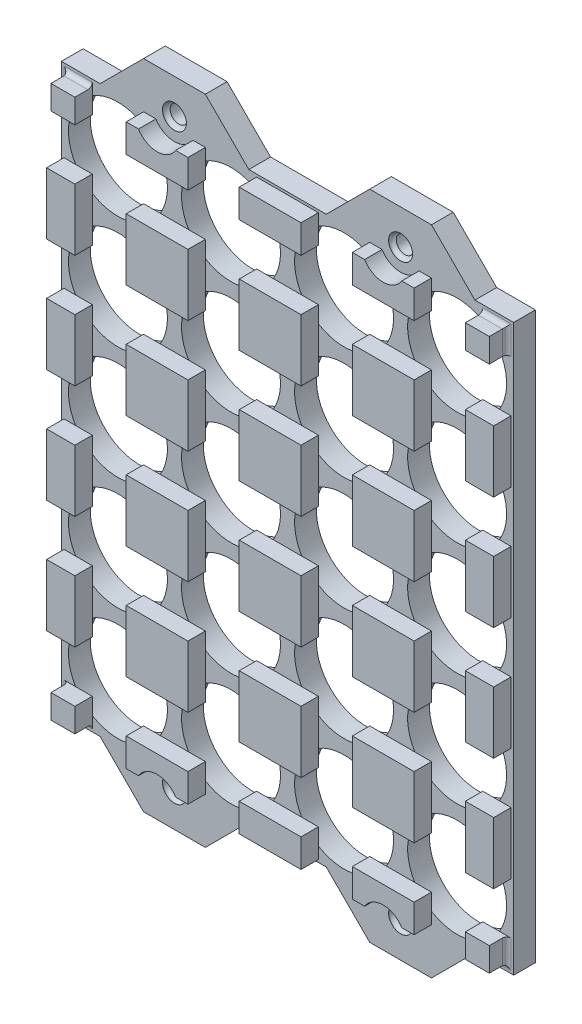
from build123d import *

# Parameters (mm, degrees)
SZKIC1_W                         = 104
SZKIC1_H                         = 26
SZKIC1_R                         = 11.376078461
DODANIE_WYCI_GNI_CIE1_DEPTH      = 5
DODANIE_WYCI_GNI_CIE7_START      = 5
SZKIC15_W                        = 5.5
SZKIC15_H                        = 5.5
DODANIE_WYCI_GNI_CIE7_DEPTH      = 4
ZAOKR_GLENIE9_R                  = 1
SZYK_LINIOWY9_COUNT              = 5
SZYK_LINIOWY9_PITCH              = 26
ZAOKR_GLENIE9_OF_SZYK_LINIOWY9_R = 1
SZKIC16_W                        = 14.2
SZKIC16_H                        = 14.2
SZKIC16_H_2                      = 6.5
SZKIC16_W_2                      = 6.5
DODANIE_WYCI_GNI_CIE8_DEPTH      = 4
SZKIC17_W                        = 14.2
SZKIC17_H                        = 5
DODANIE_WYCI_GNI_CIE9_DEPTH      = 10
SZKIC19_R                        = 2
WYTNIJ_WYCI_GNI_CIE1_DEPTH       = 10
WYTNIJ_WYCI_GNI_CIE2_START       = -5
SZKIC19_4_R                      = 5
WYTNIJ_WYCI_GNI_CIE2_DEPTH       = 10
SFAZOWANIE2_SIZE                 = 10
SZKIC20_R                        = 2.75
WYTNIJ_WYCI_GNI_CIE3_DEPTH       = 1
ZAOKR_GLENIE10_R                 = 1


# Some blends are built 0.0001 mm under size
with BuildPart() as part:
    # Szkic1 → Dodanie-wyciągnięcie1 (new body)
    with BuildSketch(Plane.XY):
        with Locations((31.794588102, -4.944794966)):
            Rectangle(SZKIC1_W, SZKIC1_H)
        with Locations((-7.205411898, -4.944794966)):
            Circle(SZKIC1_R, mode=Mode.SUBTRACT)
        with Locations((18.794588102, -4.944794966)):
            Circle(SZKIC1_R, mode=Mode.SUBTRACT)
        with Locations((44.794588102, -4.944794966)):
            Circle(SZKIC1_R, mode=Mode.SUBTRACT)
        with Locations((70.794588102, -4.944794966)):
            Circle(SZKIC1_R, mode=Mode.SUBTRACT)
    dodanie_wyci_gni_cie1 = extrude(amount=DODANIE_WYCI_GNI_CIE1_DEPTH)

    # Szkic15 → Dodanie-wyciągnięcie7 (add)
    with BuildSketch(Plane.XY.offset(DODANIE_WYCI_GNI_CIE7_START)):
        with Locations((-15.855411898, 3.705205034)):
            Rectangle(SZKIC15_W, SZKIC15_H)
        with Locations((1.444588102, 3.705205034)):
            Rectangle(SZKIC15_W, SZKIC15_H)
        with Locations((10.144588102, 3.705205034)):
            Rectangle(SZKIC15_W, SZKIC15_H)
        with Locations((27.444588102, 3.705205034)):
            Rectangle(SZKIC15_W, SZKIC15_H)
        with Locations((36.144588102, 3.705205034)):
            Rectangle(SZKIC15_W, SZKIC15_H)
        with Locations((53.444588102, 3.705205034)):
            Rectangle(SZKIC15_W, SZKIC15_H)
        with Locations((62.144588102, 3.705205034)):
            Rectangle(SZKIC15_W, SZKIC15_H)
        with Locations((79.444588102, 3.705205034)):
            Rectangle(SZKIC15_W, SZKIC15_H)
        with Locations((79.444588102, -13.594794966)):
            Rectangle(SZKIC15_W, SZKIC15_H)
        with Locations((62.144588102, -13.594794966)):
            Rectangle(SZKIC15_W, SZKIC15_H)
        with Locations((53.444588102, -13.594794966)):
            Rectangle(SZKIC15_W, SZKIC15_H)
        with Locations((36.144588102, -13.594794966)):
            Rectangle(SZKIC15_W, SZKIC15_H)
        with Locations((27.444588102, -13.594794966)):
            Rectangle(SZKIC15_W, SZKIC15_H)
        with Locations((10.144588102, -13.594794966)):
            Rectangle(SZKIC15_W, SZKIC15_H)
        with Locations((1.444588102, -13.594794966)):
            Rectangle(SZKIC15_W, SZKIC15_H)
        with Locations((-15.855411898, -13.594794966)):
            Rectangle(SZKIC15_W, SZKIC15_H)
    dodanie_wyci_gni_cie7 = extrude(amount=DODANIE_WYCI_GNI_CIE7_DEPTH)

    # Zaokrąglenie9
    zaokr_glenie9_edges = [part.edges().sort_by_distance(p)[0] for p in [
        (10.144588102, 6.455205034, 5),
        (7.394588102, 3.705205034, 5),
        (1.444588102, -16.344794966, 5),
        (4.194588102, -13.594794966, 5),
        (53.444588102, -16.344794966, 5),
        (56.194588102, -13.594794966, 5),
        (79.444588102, 6.455205034, 5),
        (82.194588102, 3.705205034, 5),
        (79.444588102, -16.344794966, 5),
        (82.194588102, -13.594794966, 5),
        (62.144588102, -16.344794966, 5),
        (59.394588102, -13.594794966, 5),
        (62.144588102, 6.455205034, 5),
        (59.394588102, 3.705205034, 5),
        (53.444588102, 6.455205034, 5),
        (56.194588102, 3.705205034, 5),
        (27.444588102, -16.344794966, 5),
        (30.194588102, -13.594794966, 5),
        (-15.855411898, -16.344794966, 5),
        (-18.605411898, -13.594794966, 5),
        (36.144588102, -16.344794966, 5),
        (33.394588102, -13.594794966, 5),
        (36.144588102, 6.455205034, 5),
        (33.394588102, 3.705205034, 5),
        (27.444588102, 6.455205034, 5),
        (30.194588102, 3.705205034, 5),
        (10.144588102, -16.344794966, 5),
        (7.394588102, -13.594794966, 5),
        (-15.855411898, 6.455205034, 5),
        (-18.605411898, 3.705205034, 5),
        (1.444588102, 6.455205034, 5),
        (4.194588102, 3.705205034, 5),
    ]]
    fillet(zaokr_glenie9_edges, radius=ZAOKR_GLENIE9_R)

    # Szyk liniowy9: Dodanie-wyciągnięcie1, Dodanie-wyciągnięcie7 ×5
    with Locations(*[(0, i * SZYK_LINIOWY9_PITCH, 0) for i in range(1, SZYK_LINIOWY9_COUNT)]):
        add(dodanie_wyci_gni_cie1)
        add(dodanie_wyci_gni_cie7)

    # Zaokrąglenie9 of Szyk liniowy9
    zaokr_glenie9_of_szyk_liniowy9_edges = [part.edges().sort_by_distance(p)[0] for p in [
        (10.144588102, 32.455205034, 5),
        (7.394588102, 29.705205034, 5),
        (1.444588102, 9.655205034, 5),
        (4.194588102, 12.405205034, 5),
        (53.444588102, 9.655205034, 5),
        (56.194588102, 12.405205034, 5),
        (79.444588102, 32.455205034, 5),
        (82.194588102, 29.705205034, 5),
        (79.444588102, 9.655205034, 5),
        (82.194588102, 12.405205034, 5),
        (62.144588102, 9.655205034, 5),
        (59.394588102, 12.405205034, 5),
        (62.144588102, 32.455205034, 5),
        (59.394588102, 29.705205034, 5),
        (53.444588102, 32.455205034, 5),
        (56.194588102, 29.705205034, 5),
        (27.444588102, 9.655205034, 5),
        (30.194588102, 12.405205034, 5),
        (-15.855411898, 9.655205034, 5),
        (-18.605411898, 12.405205034, 5),
        (36.144588102, 9.655205034, 5),
        (33.394588102, 12.405205034, 5),
        (36.144588102, 32.455205034, 5),
        (33.394588102, 29.705205034, 5),
        (27.444588102, 32.455205034, 5),
        (30.194588102, 29.705205034, 5),
        (10.144588102, 9.655205034, 5),
        (7.394588102, 12.405205034, 5),
        (-15.855411898, 32.455205034, 5),
        (-18.605411898, 29.705205034, 5),
        (1.444588102, 32.455205034, 5),
        (4.194588102, 29.705205034, 5),
        (10.144588102, 58.455205034, 5),
        (7.394588102, 55.705205034, 5),
        (1.444588102, 35.655205034, 5),
        (4.194588102, 38.405205034, 5),
        (53.444588102, 35.655205034, 5),
        (56.194588102, 38.405205034, 5),
        (79.444588102, 58.455205034, 5),
        (82.194588102, 55.705205034, 5),
        (79.444588102, 35.655205034, 5),
        (82.194588102, 38.405205034, 5),
        (62.144588102, 35.655205034, 5),
        (59.394588102, 38.405205034, 5),
        (62.144588102, 58.455205034, 5),
        (59.394588102, 55.705205034, 5),
        (53.444588102, 58.455205034, 5),
        (56.194588102, 55.705205034, 5),
        (27.444588102, 35.655205034, 5),
        (30.194588102, 38.405205034, 5),
        (-15.855411898, 35.655205034, 5),
        (-18.605411898, 38.405205034, 5),
        (36.144588102, 35.655205034, 5),
        (33.394588102, 38.405205034, 5),
        (36.144588102, 58.455205034, 5),
        (33.394588102, 55.705205034, 5),
        (27.444588102, 58.455205034, 5),
        (30.194588102, 55.705205034, 5),
        (10.144588102, 35.655205034, 5),
        (7.394588102, 38.405205034, 5),
        (-15.855411898, 58.455205034, 5),
        (-18.605411898, 55.705205034, 5),
        (1.444588102, 58.455205034, 5),
        (4.194588102, 55.705205034, 5),
        (10.144588102, 84.455205034, 5),
        (7.394588102, 81.705205034, 5),
        (1.444588102, 61.655205034, 5),
        (4.194588102, 64.405205034, 5),
        (53.444588102, 61.655205034, 5),
        (56.194588102, 64.405205034, 5),
        (79.444588102, 84.455205034, 5),
        (82.194588102, 81.705205034, 5),
        (79.444588102, 61.655205034, 5),
        (82.194588102, 64.405205034, 5),
        (62.144588102, 61.655205034, 5),
        (59.394588102, 64.405205034, 5),
        (62.144588102, 84.455205034, 5),
        (59.394588102, 81.705205034, 5),
        (53.444588102, 84.455205034, 5),
        (56.194588102, 81.705205034, 5),
        (27.444588102, 61.655205034, 5),
        (30.194588102, 64.405205034, 5),
        (-15.855411898, 61.655205034, 5),
        (-18.605411898, 64.405205034, 5),
        (36.144588102, 61.655205034, 5),
        (33.394588102, 64.405205034, 5),
        (36.144588102, 84.455205034, 5),
        (33.394588102, 81.705205034, 5),
        (27.444588102, 84.455205034, 5),
        (30.194588102, 81.705205034, 5),
        (10.144588102, 61.655205034, 5),
        (7.394588102, 64.405205034, 5),
        (-15.855411898, 84.455205034, 5),
        (-18.605411898, 81.705205034, 5),
        (1.444588102, 84.455205034, 5),
        (4.194588102, 81.705205034, 5),
        (10.144588102, 110.455205034, 5),
        (7.394588102, 107.705205034, 5),
        (1.444588102, 87.655205034, 5),
        (4.194588102, 90.405205034, 5),
        (53.444588102, 87.655205034, 5),
        (56.194588102, 90.405205034, 5),
        (79.444588102, 110.455205034, 5),
        (82.194588102, 107.705205034, 5),
        (79.444588102, 87.655205034, 5),
        (82.194588102, 90.405205034, 5),
        (62.144588102, 87.655205034, 5),
        (59.394588102, 90.405205034, 5),
        (62.144588102, 110.455205034, 5),
        (59.394588102, 107.705205034, 5),
        (53.444588102, 110.455205034, 5),
        (56.194588102, 107.705205034, 5),
        (27.444588102, 87.655205034, 5),
        (30.194588102, 90.405205034, 5),
        (-15.855411898, 87.655205034, 5),
        (-18.605411898, 90.405205034, 5),
        (36.144588102, 87.655205034, 5),
        (33.394588102, 90.405205034, 5),
        (36.144588102, 110.455205034, 5),
        (33.394588102, 107.705205034, 5),
        (27.444588102, 110.455205034, 5),
        (30.194588102, 107.705205034, 5),
        (10.144588102, 87.655205034, 5),
        (7.394588102, 90.405205034, 5),
        (-15.855411898, 110.455205034, 5),
        (-18.605411898, 107.705205034, 5),
        (1.444588102, 110.455205034, 5),
        (4.194588102, 107.705205034, 5),
    ]]
    fillet(zaokr_glenie9_of_szyk_liniowy9_edges, radius=ZAOKR_GLENIE9_OF_SZYK_LINIOWY9_R)

    # Szkic16 → Dodanie-wyciągnięcie8 (add)
    with BuildSketch(Plane.XY.offset(5)):
        with Locations((5.794588102, 86.055205034)):
            Rectangle(SZKIC16_W, SZKIC16_H)
        with Locations((31.794588102, 86.055205034)):
            Rectangle(SZKIC16_W, SZKIC16_H)
        with Locations((57.794588102, 86.055205034)):
            Rectangle(SZKIC16_W, SZKIC16_H)
        with Locations((5.794588102, 60.055205034)):
            Rectangle(SZKIC16_W, SZKIC16_H)
        with Locations((31.794588102, 60.055205034)):
            Rectangle(SZKIC16_W, SZKIC16_H)
        with Locations((57.794588102, 60.055205034)):
            Rectangle(SZKIC16_W, SZKIC16_H)
        with Locations((57.794588102, 34.055205034)):
            Rectangle(SZKIC16_W, SZKIC16_H)
        with Locations((31.794588102, 34.055205034)):
            Rectangle(SZKIC16_W, SZKIC16_H)
        with Locations((5.794588102, 34.055205034)):
            Rectangle(SZKIC16_W, SZKIC16_H)
        with Locations((5.794588102, 8.055205034)):
            Rectangle(SZKIC16_W, SZKIC16_H)
        with Locations((31.794588102, 8.055205034)):
            Rectangle(SZKIC16_W, SZKIC16_H)
        with Locations((57.794588102, 8.055205034)):
            Rectangle(SZKIC16_W, SZKIC16_H)
        with Locations((5.794588102, 108.205205034)):
            Rectangle(SZKIC16_W, SZKIC16_H_2)
        with Locations((31.794588102, 108.205205034)):
            Rectangle(SZKIC16_W, SZKIC16_H_2)
        with Locations((57.794588102, 108.205205034)):
            Rectangle(SZKIC16_W, SZKIC16_H_2)
        with Locations((79.944588102, 86.055205034)):
            Rectangle(SZKIC16_W_2, SZKIC16_H)
        with Locations((79.944588102, 60.055205034)):
            Rectangle(SZKIC16_W_2, SZKIC16_H)
        with Locations((79.944588102, 34.055205034)):
            Rectangle(SZKIC16_W_2, SZKIC16_H)
        with Locations((79.944588102, 8.055205034)):
            Rectangle(SZKIC16_W_2, SZKIC16_H)
        with Locations((57.794588102, -14.094794966)):
            Rectangle(SZKIC16_W, SZKIC16_H_2)
        with Locations((31.794588102, -14.094794966)):
            Rectangle(SZKIC16_W, SZKIC16_H_2)
        with Locations((5.794588102, -14.094794966)):
            Rectangle(SZKIC16_W, SZKIC16_H_2)
        with Locations((-16.355411898, 8.055205034)):
            Rectangle(SZKIC16_W_2, SZKIC16_H)
        with Locations((-16.355411898, 34.055205034)):
            Rectangle(SZKIC16_W_2, SZKIC16_H)
        with Locations((-16.355411898, 60.055205034)):
            Rectangle(SZKIC16_W_2, SZKIC16_H)
        with Locations((-16.355411898, 86.055205034)):
            Rectangle(SZKIC16_W_2, SZKIC16_H)
    extrude(amount=DODANIE_WYCI_GNI_CIE8_DEPTH)

    # Szkic17 → Dodanie-wyciągnięcie9 (add)
    with BuildSketch(Plane(origin=(0, 112.055205034, 0), x_dir=(1, 0, 0), z_dir=(0, 1, 0))):
        with Locations((5.794588102, -2.5)):
            Rectangle(SZKIC17_W, SZKIC17_H)
        with Locations((57.794588102, -2.5)):
            Rectangle(SZKIC17_W, SZKIC17_H)
    dodanie_wyci_gni_cie9 = extrude(amount=DODANIE_WYCI_GNI_CIE9_DEPTH)

    # Szkic19 → Wytnij-wyciągnięcie1 (cut)
    with BuildSketch(Plane(origin=(0, 0, 0), x_dir=(-1, 0, 0), z_dir=(0, 0, -1))):
        with Locations((-57.794588102, 114.055205034)):
            Circle(SZKIC19_R)
        with Locations(Location((-5.794588102, 114.055205034, 0), (0, 0, 180))):
            Circle(SZKIC19_R)
    wytnij_wyci_gni_cie1 = extrude(amount=-WYTNIJ_WYCI_GNI_CIE1_DEPTH, mode=Mode.SUBTRACT)

    # Szkic19<4> → Wytnij-wyciągnięcie2 (cut)
    with BuildSketch(Plane(origin=(0, 0, 0), x_dir=(-1, 0, 0), z_dir=(0, 0, -1)).offset(WYTNIJ_WYCI_GNI_CIE2_START)):
        with Locations((-57.794588102, 114.055205034)):
            Circle(SZKIC19_4_R)
        with Locations((-5.794588102, 114.055205034)):
            Circle(SZKIC19_4_R)
    wytnij_wyci_gni_cie2 = extrude(amount=-WYTNIJ_WYCI_GNI_CIE2_DEPTH, mode=Mode.SUBTRACT)

    # Lustro1: Dodanie-wyciągnięcie9, Wytnij-wyciągnięcie1, Wytnij-wyciągnięcie2 across plane
    add(dodanie_wyci_gni_cie9.mirror(Plane.ZX.offset(47.055205034)))
    add(wytnij_wyci_gni_cie1.mirror(Plane.ZX.offset(47.055205034)), mode=Mode.SUBTRACT)
    add(wytnij_wyci_gni_cie2.mirror(Plane.ZX.offset(47.055205034)), mode=Mode.SUBTRACT)

    # Sfazowanie2
    sfazowanie2_edges = [part.edges().sort_by_distance(p)[0] for p in [
        (12.894588102, 112.055205034, 2.5),
        (64.894588102, -17.944794966, 2.5),
        (12.894588102, -17.944794966, 2.5),
        (50.694588102, -17.944794966, 2.5),
        (-1.305411898, -17.944794966, 2.5),
        (64.894588102, 112.055205034, 2.5),
        (50.694588102, 112.055205034, 2.5),
        (-1.305411898, 112.055205034, 2.5),
    ]]
    chamfer(sfazowanie2_edges, length=SFAZOWANIE2_SIZE - 0.0001)  # a hair under: the kernel refuses the full size

    # Szkic20 → Wytnij-wyciągnięcie3 (cut)
    with BuildSketch(Plane.XY.offset(5)):
        with Locations((5.794588102, 114.055205034)):
            Circle(SZKIC20_R)
        with Locations((57.794588102, 114.055205034)):
            Circle(SZKIC20_R)
        with Locations(Location((5.794588102, -19.944794966, 0), (0, 0, 180))):
            Circle(SZKIC20_R)
        with Locations((57.794588102, -19.944794966)):
            Circle(SZKIC20_R)
    extrude(amount=-WYTNIJ_WYCI_GNI_CIE3_DEPTH, mode=Mode.SUBTRACT)

    # Zaokrąglenie10
    # the kernel refuses this fillet: 1 mm, written as the material it adds along each edge
    with BuildSketch(Plane(origin=(57.794588102, 114.055205034, 4), x_dir=(1, 0, 0), z_dir=(0, -1, 0))) as zaokr_glenie10_piece_1:
        with BuildLine():
            CenterArc((1.75, 0.968245837), ZAOKR_GLENIE10_R, 284.477512186, 75.522487814)
            Line((2, 0), (2.005, -0.019364917))
            ThreePointArc((2.005, -0.019364917), (2.375, -0.02), (2.75, -0.02))
            Line((2.75, -0.02), (2.77, 0))
            Line((2.77, 0), (2.77, 0.968245837))
            Line((2.77, 0.968245837), (2.75, 0.968245837))
        make_face()
    revolve(axis=Axis((57.794588102, 114.055205034, 4), (0, 0, 1)))
    with BuildSketch(Plane(origin=(5.794588102, -19.944794966, 4), x_dir=(-1, 0, 0), z_dir=(0, 1, 0))) as zaokr_glenie10_piece_2:
        with BuildLine():
            CenterArc((1.75, 0.968245837), ZAOKR_GLENIE10_R, 284.477512186, 75.522487814)
            Line((2, 0), (2.005, -0.019364917))
            ThreePointArc((2.005, -0.019364917), (2.375, -0.02), (2.75, -0.02))
            Line((2.75, -0.02), (2.77, 0))
            Line((2.77, 0), (2.77, 0.968245837))
            Line((2.77, 0.968245837), (2.75, 0.968245837))
        make_face()
    revolve(axis=Axis((5.794588102, -19.944794966, 4), (0, 0, 1)))
    with BuildSketch(Plane(origin=(57.794588102, -19.944794966, 4), x_dir=(1, 0, 0), z_dir=(0, -1, 0))) as zaokr_glenie10_piece_3:
        with BuildLine():
            CenterArc((1.75, 0.968245837), ZAOKR_GLENIE10_R, 284.477512186, 75.522487814)
            Line((2, 0), (2.005, -0.019364917))
            ThreePointArc((2.005, -0.019364917), (2.375, -0.02), (2.75, -0.02))
            Line((2.75, -0.02), (2.77, 0))
            Line((2.77, 0), (2.77, 0.968245837))
            Line((2.77, 0.968245837), (2.75, 0.968245837))
        make_face()
    revolve(axis=Axis((57.794588102, -19.944794966, 4), (0, 0, 1)))
    with BuildSketch(Plane(origin=(5.794588102, 114.055205034, 4), x_dir=(1, 0, 0), z_dir=(0, -1, 0))) as zaokr_glenie10_piece_4:
        with BuildLine():
            CenterArc((1.75, 0.968245837), ZAOKR_GLENIE10_R, 284.477512186, 75.522487814)
            Line((2, 0), (2.005, -0.019364917))
            ThreePointArc((2.005, -0.019364917), (2.375, -0.02), (2.75, -0.02))
            Line((2.75, -0.02), (2.77, 0))
            Line((2.77, 0), (2.77, 0.968245837))
            Line((2.77, 0.968245837), (2.75, 0.968245837))
        make_face()
    revolve(axis=Axis((5.794588102, 114.055205034, 4), (0, 0, 1)))


solid = part.part
